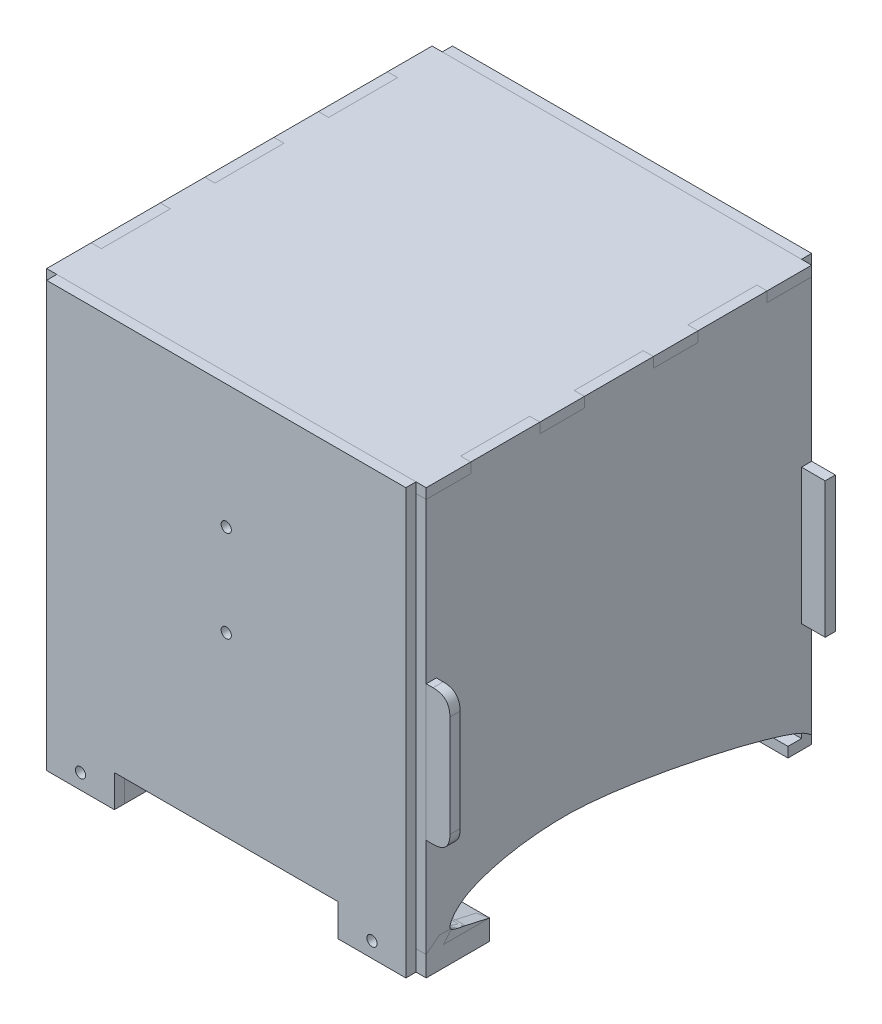
from build123d import *

# Parameters (mm, degrees)
SALIENTE_EXTRUIR1_DEPTH       = 3
CROQUIS3_W                    = 13.15701814
CROQUIS3_H                    = 3
CORTAR_EXTRUIR1_DEPTH         = 15
SALIENTE_EXTRUIR2_START       = 114.078454
SALIENTE_EXTRUIR2_DEPTH       = 3
CROQUIS15_W                   = 3
CROQUIS15_H                   = 40
SALIENTE_EXTRUIR12_DEPTH      = 30
SALIENTE_EXTRUIR12_2_DEPTH    = 30
REDONDEO1_SIZE                = 5
SALIENTE_EXTRUIR15_START      = 7.300369
CROQUIS18_W                   = 106
CROQUIS18_H                   = 116.289323387
SALIENTE_EXTRUIR15_DEPTH      = 3
SALIENTE_EXTRUIR16_DEPTH      = 3
SALIENTE_EXTRUIR16_DEPTH_BACK = 20
SALIENTE_EXTRUIR18_START      = -106.43763
CROQUIS25_W                   = 106
CROQUIS25_H                   = 116.289323387
SALIENTE_EXTRUIR18_DEPTH      = 3
CORTAR_EXTRUIR7_START         = 10.300369
CROQUIS28_W                   = 66
CROQUIS28_H                   = 3.5
CORTAR_EXTRUIR7_DEPTH         = 3
CORTAR_EXTRUIR8_START         = 10.300369
CROQUIS30_R                   = 1.5
CORTAR_EXTRUIR8_DEPTH         = 119.737999343
CORTAR_EXTRUIR9_START         = -109.43763
CROQUIS31_W                   = 66
CROQUIS31_H                   = 4
CORTAR_EXTRUIR9_DEPTH         = 10
CROQUIS33_W                   = 20
CROQUIS33_H                   = 3
SALIENTE_EXTRUIR19_DEPTH      = 5.384845
SALIENTE_EXTRUIR20_START      = -109.43763
CROQUIS35_W                   = 20
CROQUIS35_H                   = 3
SALIENTE_EXTRUIR20_DEPTH      = 7
SALIENTE_EXTRUIR21_START      = 114.078454
CROQUIS36_W                   = 106
CROQUIS36_H                   = 3
SALIENTE_EXTRUIR21_DEPTH      = 3
CROQUIS38_W                   = 23
CROQUIS38_H                   = 18.705339094
SALIENTE_EXTRUIR22_DEPTH      = 6
SALIENTE_EXTRUIR23_START      = -2.210869
CROQUIS40_W                   = 20
CROQUIS40_H                   = 3
SALIENTE_EXTRUIR23_DEPTH      = 6
CORTAR_EXTRUIR10_START        = -2.699630711
CORTAR_EXTRUIR10_OUTLINE_R    = 1.5
CORTAR_EXTRUIR10_DEPTH        = 10
CORTAR_EXTRUIR10_START_2      = 6
CORTAR_EXTRUIR10_2_OUTLINE_R  = 1.5
CORTAR_EXTRUIR10_2_DEPTH      = 5
CORTAR_EXTRUIR10_3_OUTLINE_R  = 1.5
CORTAR_EXTRUIR10_3_DEPTH      = 10.699630711


with BuildPart() as part:
    # Croquis1 → Saliente-Extruir1 (new body)
    with BuildSketch(Plane(origin=(0, 0, 0), x_dir=(0, 0, -1), z_dir=(1, 0, 0))):
        with BuildLine():
            Line((4.244837142, -0.612549734), (11.404969805, -2.210869057))
            Line((11.404969805, -2.210869057), (-7.300369289, -2.210869057))
            Line((-7.300369289, -2.210869057), (-7.300369289, 117.07845433))
            Line((-7.300369289, 117.07845433), (106.437630053, 117.07845433))
            Line((106.437630053, 117.07845433), (106.437630053, -2.92154567))
            add(Edge.make_bspline(
                [(106.437630053, -2.92154567), (106.158792534, -2.718508956), (105.446901231, -2.200142306), (104.221740642, -1.353584112), (102.512019097, -0.59332196), (100.51305141, 0.188412628), (98.219896235, 0.97707791), (95.729577527, 1.761651869), (93.115986838, 2.527384686), (90.430721895, 3.268901643), (87.701518373, 3.98636616), (84.942790708, 4.678644436), (82.162571764, 5.347282557), (79.367528855, 5.994747091), (76.561513682, 6.620538493), (73.746486309, 7.223844096), (70.924132029, 7.807080052), (68.097254661, 8.369647004), (65.267202927, 8.91022382), (62.435043178, 9.42822055), (59.603741326, 9.924185517), (56.777235519, 10.394601385), (53.959931446, 10.83651543), (51.155696987, 11.246133142), (48.366549787, 11.618087778), (45.591515898, 11.946872993), (42.836151579, 12.230287463), (40.118237465, 12.463930186), (37.452602805, 12.635449716), (34.827619267, 12.723040877), (32.216703596, 12.722748074), (29.600422126, 12.642250546), (26.978957203, 12.485279692), (24.359781654, 12.250237065), (21.757342017, 11.943381129), (19.192566531, 11.56670344), (16.684024448, 11.111296975), (14.247569846, 10.571669885), (11.903714568, 9.954969168), (9.69231849, 9.262375326), (7.667237328, 8.506283272), (5.87986852, 7.712109821), (4.366672919, 6.886521217), (3.140252556, 6.045340184), (2.171886619, 5.239428607), (1.429627225, 4.507263509), (0.879433629, 3.860559801), (0.477092978, 3.296637147), (0.184455256, 2.805190677), (-0.017518396, 2.370544335), (-0.150213288, 1.981594603), (-0.2391334, 1.628917298), (-0.292888695, 1.298804423), (-0.255124599, 0.97199236), (-0.086070543, 0.677073198), (0.193197357, 0.426266794), (0.59404042, 0.249756853), (1.095020744, 0.085493032), (1.723246947, -0.115823128), (2.553285773, -0.318911326), (3.414668002, -0.478611918), (4.011337666, -0.57632275), (4.244837142, -0.612549734)],
                knots=[0, 0, 0, 0, 0.004715894, 0.01204, 0.020287821, 0.030195472, 0.0413911, 0.053412755, 0.065878002, 0.078607694, 0.091482853, 0.104442348, 0.117477413, 0.130560888, 0.143651174, 0.156766768, 0.169904977, 0.183036823, 0.196156815, 0.209280047, 0.222383535, 0.235438894, 0.248438616, 0.2613557, 0.274168157, 0.286892082, 0.299543833, 0.312020768, 0.324170817, 0.336044207, 0.347907804, 0.35984604, 0.371810795, 0.383792396, 0.395779194, 0.407618325, 0.419213754, 0.430614116, 0.441713966, 0.452326008, 0.462269679, 0.471239765, 0.479034418, 0.485791791, 0.4915297, 0.496230285, 0.500022928, 0.503118663, 0.505687265, 0.50782878, 0.509656055, 0.511294271, 0.512798175, 0.514207546, 0.515693342, 0.51733772, 0.519252873, 0.521624793, 0.524554252, 0.528261589, 0.533294383, 0.536523453, 0.536523453, 0.536523453, 0.536523453], degree=3))
        make_face()
    extrude(amount=SALIENTE_EXTRUIR1_DEPTH)

    # Croquis3 → Cortar-Extruir1 (cut)
    with BuildSketch(Plane(origin=(3, 0, 0), x_dir=(0, 0, -1), z_dir=(1, 0, 0))):
        with Locations((32.805133515, 115.57845433)):
            Rectangle(CROQUIS3_W, CROQUIS3_H)
        with Locations((-0.721860219, 115.57845433)):
            Rectangle(CROQUIS3_W, CROQUIS3_H)
        with Locations((66.332127249, 115.57845433)):
            Rectangle(CROQUIS3_W, CROQUIS3_H)
        with Locations((99.859120983, 115.57845433)):
            Rectangle(CROQUIS3_W, CROQUIS3_H)
    extrude(amount=-CORTAR_EXTRUIR1_DEPTH, mode=Mode.SUBTRACT)


with BuildPart() as body_2:
    # Simetría3: mirrored copy
    add(part.part.mirror(Plane(origin=(-43, 0, -87.582626556), x_dir=(0, 0, 1), z_dir=(-1, 0, 0))))


with BuildPart() as body_3:
    # Croquis4 → Saliente-Extruir2 (new body)
    with BuildSketch(Plane(origin=(0, 0, 0), x_dir=(1, 0, 0), z_dir=(0, 1, 0)).offset(SALIENTE_EXTRUIR2_START)):
        Polygon((-86, 106.437630053), (-89, 106.437630053), (-89, 93.280611913), (-86, 93.280611913), (-86, 72.910636319), (-89, 72.910636319), (-89, 59.753618179), (-86, 59.753618179), (-86, 39.383642585), (-89, 39.383642585), (-89, 26.226624445), (-86, 26.226624445), (-86, 5.856648851), (-89, 5.856648851), (-89, -7.300369289), (-86, -7.300369289), (20, -7.300369289), (23, -7.300369289), (23, 5.856648851), (20, 5.856648851), (20, 26.226624445), (23, 26.226624445), (23, 39.383642585), (20, 39.383642585), (20, 59.753618179), (23, 59.753618179), (23, 72.910636319), (20, 72.910636319), (20, 93.280611913), (23, 93.280611913), (23, 106.437630053), (20, 106.437630053), align=None)
    extrude(amount=SALIENTE_EXTRUIR2_DEPTH)


with BuildPart() as body_4:
    # Croquis15 → Saliente-Extruir12 (new body)
    with BuildSketch(Plane(origin=(0, 0, 0), x_dir=(0, 0, -1), z_dir=(1, 0, 0))):
        with Locations((-5.800369289, 46.963463689)):
            Rectangle(CROQUIS15_W, CROQUIS15_H)
    extrude(amount=SALIENTE_EXTRUIR12_DEPTH)

    # Redondeo1
    # a fillet whose section is not a circle: 5 mm, written as the material it takes off along each edge
    with BuildSketch(Plane(origin=(30, 66.963463689, 19.800369289), x_dir=(-1, 0, 0), z_dir=(0, 0, -1)), Plane(origin=(30, 26.963463689, -8.199630711), x_dir=(-1, 0, 0), z_dir=(0, 0, 1))) as redondeo1_piece_1:
        with BuildLine():
            Bezier((REDONDEO1_SIZE, 0), (0, 0), (0, -REDONDEO1_SIZE), weights=[1, 1, 1])
            Line((0, -REDONDEO1_SIZE), (0, 0))
            Line((0, 0), (REDONDEO1_SIZE, 0))
        make_face()
    extrude(amount=28, mode=Mode.SUBTRACT)
    with BuildSketch(Plane(origin=(0, 26.963463689, -8.199630711), x_dir=(1, 0, 0), z_dir=(0, 0, 1)), Plane(origin=(0, 66.963463689, 19.800369289), x_dir=(1, 0, 0), z_dir=(0, 0, -1))) as redondeo1_piece_2:
        with BuildLine():
            Bezier((REDONDEO1_SIZE, 0), (0, 0), (0, REDONDEO1_SIZE), weights=[1, 1, 1])
            Line((0, REDONDEO1_SIZE), (0, 0))
            Line((0, 0), (REDONDEO1_SIZE, 0))
        make_face()
    extrude(amount=28, mode=Mode.SUBTRACT)


with BuildPart() as body_5:
    # Croquis15 → Saliente-Extruir12 2 (new body)
    with BuildSketch(Plane(origin=(0, 0, 0), x_dir=(0, 0, -1), z_dir=(1, 0, 0))):
        with Locations((104.937630053, 46.963463689)):
            Rectangle(CROQUIS15_W, CROQUIS15_H)
    extrude(amount=SALIENTE_EXTRUIR12_2_DEPTH)


with BuildPart() as part_1:
    # Sólido-Mover/Copiar1: moved
    add(part.part.moved(Location((20, 0, 0))))


with BuildPart() as body_6:
    # Croquis18 → Saliente-Extruir15 (new body)
    with BuildSketch(Plane.XY.offset(SALIENTE_EXTRUIR15_START)):
        with Locations((-33, 55.933792637)):
            Rectangle(CROQUIS18_W, CROQUIS18_H)
    extrude(amount=SALIENTE_EXTRUIR15_DEPTH)

    # Croquis28 → Cortar-Extruir7 (cut)
    with BuildSketch(Plane.XY.offset(CORTAR_EXTRUIR7_START)):
        with Locations((-33, -0.460869057)):
            Rectangle(CROQUIS28_W, CROQUIS28_H)
    extrude(amount=-CORTAR_EXTRUIR7_DEPTH, mode=Mode.SUBTRACT)


with BuildPart() as body_7:
    # Croquis19 → Saliente-Extruir16 (new, two sides: drawn at the far end of the back side and taken through both)
    with BuildSketch(Plane.ZY.offset(86).offset(-SALIENTE_EXTRUIR16_DEPTH_BACK)):
        with BuildLine():
            Line((-11.404969805, -2.210869057), (-4.244837142, -0.612549734))
            add(Edge.make_bspline(
                [(-4.244837142, -0.612549734), (-4.011337666, -0.57632275), (-3.414668002, -0.478611918), (-2.553285773, -0.318911326), (-1.723246947, -0.115823128), (-1.095020744, 0.085493032), (-0.59404042, 0.249756853), (-0.193197357, 0.426266794), (0.031768894, 0.628305684), (0.124002996, 0.757652641), (0.143835775, 0.789130943)],
                knots=[0.463476547, 0.463476547, 0.463476547, 0.463476547, 0.466705617, 0.471738411, 0.475445748, 0.478375207, 0.480747127, 0.48266228, 0.484306658, 0.484811426, 0.484811426, 0.484811426, 0.484811426], degree=3))
            Line((0.143835775, 0.789130943), (7.300369289, 0.789130943))
            Line((7.300369289, 0.789130943), (7.300369289, -2.210869057))
            Line((7.300369289, -2.210869057), (-11.404969805, -2.210869057))
        make_face()
    extrude(amount=SALIENTE_EXTRUIR16_DEPTH + SALIENTE_EXTRUIR16_DEPTH_BACK)


with BuildPart() as body_8:
    # Croquis25 → Saliente-Extruir18 (new body)
    with BuildSketch(Plane.XY.offset(SALIENTE_EXTRUIR18_START)):
        with Locations((-33, 55.933792637)):
            Rectangle(CROQUIS25_W, CROQUIS25_H)
    extrude(amount=-SALIENTE_EXTRUIR18_DEPTH)


with BuildPart() as cortar_extruir8_tool:
    # Croquis30 → Cortar-Extruir8 (new body)
    with BuildSketch(Plane.XY.offset(CORTAR_EXTRUIR8_START)):
        with Locations((-33, 80.513463689)):
            Circle(CROQUIS30_R)
        with Locations((-33, 53.513463689)):
            Circle(CROQUIS30_R)
    extrude(amount=-CORTAR_EXTRUIR8_DEPTH)


with BuildPart() as body_6_1:
    add(body_6.part)

    # Cortar-Extruir8: cut by cortar_extruir8_tool
    add(cortar_extruir8_tool.part, mode=Mode.SUBTRACT)



with BuildPart() as body_8_1:
    add(body_8.part)

    # Cortar-Extruir8: cut by cortar_extruir8_tool
    add(cortar_extruir8_tool.part, mode=Mode.SUBTRACT)

    # Croquis31 → Cortar-Extruir9 (cut)
    with BuildSketch(Plane.XY.offset(CORTAR_EXTRUIR9_START)):
        with Locations((-33, -0.210869057)):
            Rectangle(CROQUIS31_W, CROQUIS31_H)
    extrude(amount=CORTAR_EXTRUIR9_DEPTH, mode=Mode.SUBTRACT)

    # Croquis33 → Saliente-Extruir19 (add)
    with BuildSketch(Plane(origin=(0, 0, 0), x_dir=(1, 0, 0), z_dir=(0, 1, 0))):
        with Locations((10, 107.937630053)):
            Rectangle(CROQUIS33_W, CROQUIS33_H)
        with Locations((-76, 107.937630053)):
            Rectangle(CROQUIS33_W, CROQUIS33_H)
    extrude(amount=-SALIENTE_EXTRUIR19_DEPTH)

    # Croquis35 → Saliente-Extruir20 (add)
    with BuildSketch(Plane.XY.offset(SALIENTE_EXTRUIR20_START)):
        with Locations((-76, -6.884844929)):
            Rectangle(CROQUIS35_W, CROQUIS35_H)
        with Locations((10, -6.884844929)):
            Rectangle(CROQUIS35_W, CROQUIS35_H)
    extrude(amount=SALIENTE_EXTRUIR20_DEPTH)


with BuildPart() as body_6_2:
    add(body_6_1.part)

    add(body_8_1.part)  # Saliente-Extruir21 merges body 8
    # Croquis36 → Saliente-Extruir21 (add)
    with BuildSketch(Plane(origin=(0, 0, 0), x_dir=(1, 0, 0), z_dir=(0, 1, 0)).offset(SALIENTE_EXTRUIR21_START)):
        with Locations((-33, 107.937630053)):
            Rectangle(CROQUIS36_W, CROQUIS36_H)
        with Locations((-33, -8.800369289)):
            Rectangle(CROQUIS36_W, CROQUIS36_H)
    extrude(amount=SALIENTE_EXTRUIR21_DEPTH)

    # Croquis40 → Saliente-Extruir23 (add)
    with BuildSketch(Plane(origin=(0, 0, 0), x_dir=(1, 0, 0), z_dir=(0, 1, 0)).offset(SALIENTE_EXTRUIR23_START)):
        with Locations((-76, -8.800369289)):
            Rectangle(CROQUIS40_W, CROQUIS40_H)
        with Locations((10, -8.800369289)):
            Rectangle(CROQUIS40_W, CROQUIS40_H)
    extrude(amount=-SALIENTE_EXTRUIR23_DEPTH)

    # Cortar-Extruir10 2 outline → Cortar-Extruir10 2 (cut)
    with BuildSketch(Plane.XY.offset(CORTAR_EXTRUIR10_START_2)):
        with Locations((10, -3.710869057)):
            Circle(CORTAR_EXTRUIR10_2_OUTLINE_R)
        with Locations((-76, -3.710869057)):
            Circle(CORTAR_EXTRUIR10_2_OUTLINE_R)
    extrude(amount=CORTAR_EXTRUIR10_2_DEPTH, mode=Mode.SUBTRACT)


with BuildPart() as body_8_2:
    # Simetría7: mirrored copy
    add(body_7.part.mirror(Plane(origin=(-33, 0, 10.300369289), x_dir=(0, 0, 1), z_dir=(1, 0, 0))))


with BuildPart() as body_7_1:
    add(body_7.part)

    add(body_8_2.part)  # Saliente-Extruir22 merges body 8 2
    # Croquis38 → Saliente-Extruir22 (add)
    with BuildSketch(Plane.XZ.offset(2.210869057)):
        with Locations((-77.5, -2.052300258)):
            Rectangle(CROQUIS38_W, CROQUIS38_H)
        with Locations((11.5, -2.052300258)):
            Rectangle(CROQUIS38_W, CROQUIS38_H)
    extrude(amount=SALIENTE_EXTRUIR22_DEPTH)

    # Cortar-Extruir10: read off the stored shape, not the designer's step
    # Cortar-Extruir10 outline → Cortar-Extruir10 (cut)
    with BuildSketch(Plane.XY.offset(CORTAR_EXTRUIR10_START)):
        with Locations((10, -3.710869057)):
            Circle(CORTAR_EXTRUIR10_OUTLINE_R)
    extrude(amount=CORTAR_EXTRUIR10_DEPTH, mode=Mode.SUBTRACT)

    # Cortar-Extruir10 3 outline → Cortar-Extruir10 3 (cut)
    with BuildSketch(Plane.XY.offset(CORTAR_EXTRUIR10_START)):
        with Locations((-76, -3.710869057)):
            Circle(CORTAR_EXTRUIR10_3_OUTLINE_R)
    extrude(amount=CORTAR_EXTRUIR10_3_DEPTH, mode=Mode.SUBTRACT)


solid = Compound([body_2.part, body_3.part, body_4.part, body_5.part, part_1.part, body_6_2.part, body_7_1.part])
